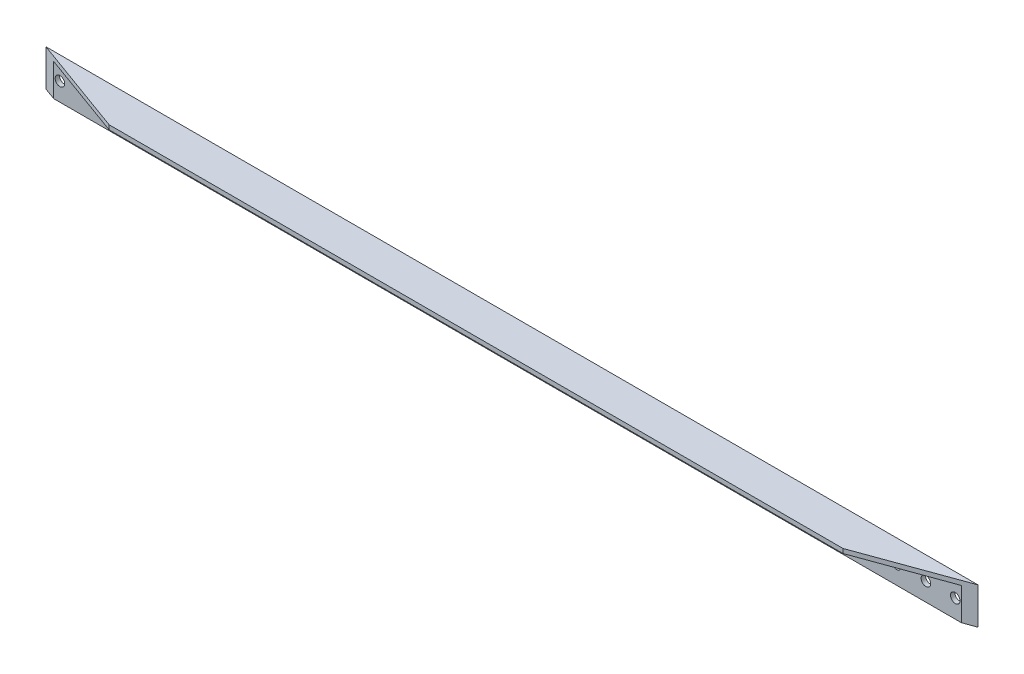
from build123d import *

# Parameters (mm, degrees)
SKETCH_1_W          = 2540
SKETCH_1_H          = 100
SKETCH_1_R          = 13
EXTRUDE_569_DEPTH   = 12
SKETCH_2_W          = 2540
SKETCH_2_H          = 12
EXTRUDE_1_DEPTH     = 86
CUT_EXTRUDE_1_DEPTH = 1278.694799238


with BuildPart() as part:
    # 草图1 → Extrude 569 (new body)
    with BuildSketch(Plane.XY):
        Rectangle(SKETCH_1_W, SKETCH_1_H)
        with Locations((1220, 0)):
            Circle(SKETCH_1_R, mode=Mode.SUBTRACT)
        with Locations((1140, 0)):
            Circle(SKETCH_1_R, mode=Mode.SUBTRACT)
        with Locations((1060, 0)):
            Circle(SKETCH_1_R, mode=Mode.SUBTRACT)
        with Locations((980, 0)):
            Circle(SKETCH_1_R, mode=Mode.SUBTRACT)
        with Locations((580, 0)):
            Circle(SKETCH_1_R, mode=Mode.SUBTRACT)
        with Locations((460, 0)):
            Circle(SKETCH_1_R, mode=Mode.SUBTRACT)
        with Locations((380, 0)):
            Circle(SKETCH_1_R, mode=Mode.SUBTRACT)
        with Locations((300, 0)):
            Circle(SKETCH_1_R, mode=Mode.SUBTRACT)
        with Locations((180, 0)):
            Circle(SKETCH_1_R, mode=Mode.SUBTRACT)
        with Locations((-180, 0)):
            Circle(SKETCH_1_R, mode=Mode.SUBTRACT)
        with Locations((-300, 0)):
            Circle(SKETCH_1_R, mode=Mode.SUBTRACT)
        with Locations((-380, 0)):
            Circle(SKETCH_1_R, mode=Mode.SUBTRACT)
        with Locations((-460, 0)):
            Circle(SKETCH_1_R, mode=Mode.SUBTRACT)
        with Locations((-580, 0)):
            Circle(SKETCH_1_R, mode=Mode.SUBTRACT)
        with Locations((-980, 0)):
            Circle(SKETCH_1_R, mode=Mode.SUBTRACT)
        with Locations((-1060, 0)):
            Circle(SKETCH_1_R, mode=Mode.SUBTRACT)
        with Locations((-1140, 0)):
            Circle(SKETCH_1_R, mode=Mode.SUBTRACT)
        with Locations((-1220, 0)):
            Circle(SKETCH_1_R, mode=Mode.SUBTRACT)
    extrude(amount=EXTRUDE_569_DEPTH)

    # 草图2 → 凸台-拉伸1 (add)
    with BuildSketch(Plane.XY.offset(12)):
        with Locations((0, 44)):
            Rectangle(SKETCH_2_W, SKETCH_2_H)
    extrude(amount=EXTRUDE_1_DEPTH)

    # 草图4 → 切除-拉伸1 (cut, through all)
    with BuildSketch(Plane(origin=(0, 50, 0), x_dir=(-1, 0, 0), z_dir=(0, 1, 0))):
        Polygon((-1270, 0), (-1270, 98), (-1000, 98), align=None)
        Polygon((1270, 0), (1000, 98), (1270, 98), align=None)
    extrude(amount=-CUT_EXTRUDE_1_DEPTH, mode=Mode.SUBTRACT)


solid = part.part
